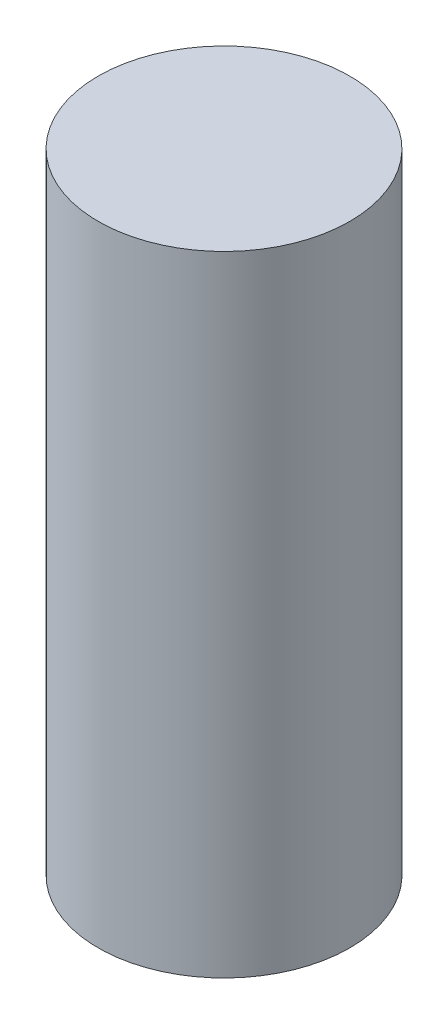
from build123d import *

# Parameters (mm, degrees)
SKETCH_1_R      = 2
EXTRUDE_1_DEPTH = 10


with BuildPart() as part:
    # 草图1 → 凸台-拉伸1 (new body)
    with BuildSketch(Plane(origin=(0, 22.5, 0), x_dir=(1, 0, 0), z_dir=(0, 1, 0))):
        with Locations((39.5, 0)):
            Circle(SKETCH_1_R)
    extrude(amount=EXTRUDE_1_DEPTH)


solid = part.part
